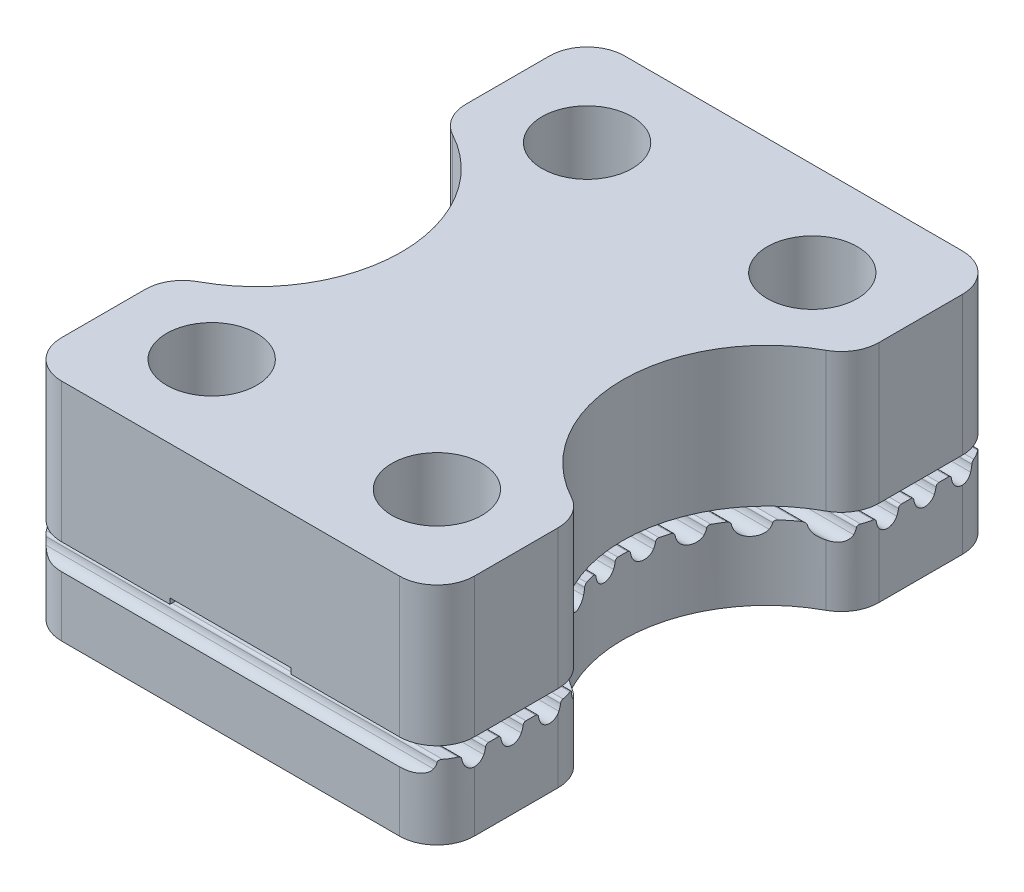
from build123d import *

# Parameters (mm, degrees)
BOSS_EXTRUDE1_DEPTH           = 12
CUT_EXTRUDE1_DEPTH            = 23.135943621
CUT_EXTRUDE1_DEPTH_BACK       = 23.135943621
SKETCH4_W                     = 2.4
SKETCH4_H                     = 12
M4_CLEARANCE_HOLE1_AT_2_COUNT = 2
M4_CLEARANCE_HOLE1_AT_2_PITCH = 12
M4_CLEARANCE_HOLE1_AT_3_COUNT = 2
M4_CLEARANCE_HOLE1_AT_3_PITCH = 20
M4_CLEARANCE_HOLE1_AT_4_COUNT = 2
M4_CLEARANCE_HOLE1_AT_4_PITCH = 23.323807579
CUT_EXTRUDE2_DEPTH            = 23.135943725
CUT_EXTRUDE2_DEPTH_BACK       = 23.135943725
SKETCH5_W                     = 6.45
SKETCH5_H                     = 0.3
FILLET1_R                     = 2
FILLET2_R                     = 2


with BuildPart() as part:
    # Sketch1 → Boss-Extrude1 (new body)
    with BuildSketch(Plane(origin=(0, 0, 0), x_dir=(1, 0, 0), z_dir=(0, 1, 0))):
        with BuildLine():
            Line((-11, -15), (11, -15))
            Line((11, -15), (11, -7.25))
            ThreePointArc((11, -7.25), (5.89374247, 0), (11, 7.25))
            Line((11, 7.25), (11, 15))
            Line((11, 15), (-11, 15))
            Line((-11, 15), (-11, 7.25))
            ThreePointArc((-11, 7.25), (-5.89374247, 0), (-11, -7.25))
            Line((-11, -7.25), (-11, -15))
        make_face()
    extrude(amount=-BOSS_EXTRUDE1_DEPTH)

    # Sketch2 → Cut-Extrude1 (cut, two sides: drawn at the far end of the back side and taken through both)
    with BuildSketch(Plane(origin=(0, 0, 0), x_dir=(0, 0, -1), z_dir=(1, 0, 0)).offset(-CUT_EXTRUDE1_DEPTH_BACK)):
        with BuildLine():
            Line((14, -7.42), (-15, -7.42))
            Line((-15, -7.42), (-16, -7.42))
            Line((-16, -7.42), (-16, -8.05))
            Line((-16, -8.05), (-15.740175425, -8.05))
            ThreePointArc((-15.740175425, -8.05), (-15.641268354, -8.087228588), (-15.591456891, -8.180434783))
            ThreePointArc((-15.591456891, -8.180434783), (-15.557611714, -8.338062154), (-15.498876404, -8.488202247))
            ThreePointArc((-15.498876404, -8.488202247), (-15, -8.8), (-14.501123596, -8.488202247))
            ThreePointArc((-14.501123596, -8.488202247), (-14.442388286, -8.338062154), (-14.408543109, -8.180434783))
            ThreePointArc((-14.408543109, -8.180434783), (-14.358731646, -8.087228588), (-14.259824575, -8.05))
            Line((-14.259824575, -8.05), (-14, -8.05))
            Line((-14, -8.05), (-13.740175425, -8.05))
            ThreePointArc((-13.740175425, -8.05), (-13.641268354, -8.087228588), (-13.591456891, -8.180434783))
            ThreePointArc((-13.591456891, -8.180434783), (-13.557611714, -8.338062154), (-13.498876404, -8.488202247))
            ThreePointArc((-13.498876404, -8.488202247), (-13, -8.8), (-12.501123596, -8.488202247))
            ThreePointArc((-12.501123596, -8.488202247), (-12.442388286, -8.338062154), (-12.408543109, -8.180434783))
            ThreePointArc((-12.408543109, -8.180434783), (-12.358731646, -8.087228588), (-12.259824575, -8.05))
            Line((-12.259824575, -8.05), (-12, -8.05))
            Line((-12, -8.05), (-11.740175425, -8.05))
            ThreePointArc((-11.740175425, -8.05), (-11.641268354, -8.087228588), (-11.591456891, -8.180434783))
            ThreePointArc((-11.591456891, -8.180434783), (-11.557611714, -8.338062154), (-11.498876404, -8.488202247))
            ThreePointArc((-11.498876404, -8.488202247), (-11, -8.8), (-10.501123596, -8.488202247))
            ThreePointArc((-10.501123596, -8.488202247), (-10.442388286, -8.338062154), (-10.408543109, -8.180434783))
            ThreePointArc((-10.408543109, -8.180434783), (-10.358731646, -8.087228588), (-10.259824575, -8.05))
            Line((-10.259824575, -8.05), (-10, -8.05))
            Line((-10, -8.05), (-9.740175425, -8.05))
            ThreePointArc((-9.740175425, -8.05), (-9.641268354, -8.087228588), (-9.591456891, -8.180434783))
            ThreePointArc((-9.591456891, -8.180434783), (-9.557611714, -8.338062154), (-9.498876404, -8.488202247))
            ThreePointArc((-9.498876404, -8.488202247), (-9, -8.8), (-8.501123596, -8.488202247))
            ThreePointArc((-8.501123596, -8.488202247), (-8.442388286, -8.338062154), (-8.408543109, -8.180434783))
            ThreePointArc((-8.408543109, -8.180434783), (-8.358731646, -8.087228588), (-8.259824575, -8.05))
            Line((-8.259824575, -8.05), (-8, -8.05))
            Line((-8, -8.05), (-7.740175425, -8.05))
            ThreePointArc((-7.740175425, -8.05), (-7.641268354, -8.087228588), (-7.591456891, -8.180434783))
            ThreePointArc((-7.591456891, -8.180434783), (-7.557611714, -8.338062154), (-7.498876404, -8.488202247))
            ThreePointArc((-7.498876404, -8.488202247), (-7, -8.8), (-6.501123596, -8.488202247))
            ThreePointArc((-6.501123596, -8.488202247), (-6.442388286, -8.338062154), (-6.408543109, -8.180434783))
            ThreePointArc((-6.408543109, -8.180434783), (-6.358731646, -8.087228588), (-6.259824575, -8.05))
            Line((-6.259824575, -8.05), (-6, -8.05))
            Line((-6, -8.05), (-5.740175425, -8.05))
            ThreePointArc((-5.740175425, -8.05), (-5.641268354, -8.087228588), (-5.591456891, -8.180434783))
            ThreePointArc((-5.591456891, -8.180434783), (-5.557611714, -8.338062154), (-5.498876404, -8.488202247))
            ThreePointArc((-5.498876404, -8.488202247), (-5, -8.8), (-4.501123596, -8.488202247))
            ThreePointArc((-4.501123596, -8.488202247), (-4.442388286, -8.338062154), (-4.408543109, -8.180434783))
            ThreePointArc((-4.408543109, -8.180434783), (-4.358731646, -8.087228588), (-4.259824575, -8.05))
            Line((-4.259824575, -8.05), (-4, -8.05))
            Line((-4, -8.05), (-3.740175425, -8.05))
            ThreePointArc((-3.740175425, -8.05), (-3.641268354, -8.087228588), (-3.591456891, -8.180434783))
            ThreePointArc((-3.591456891, -8.180434783), (-3.557611714, -8.338062154), (-3.498876404, -8.488202247))
            ThreePointArc((-3.498876404, -8.488202247), (-3, -8.8), (-2.501123596, -8.488202247))
            ThreePointArc((-2.501123596, -8.488202247), (-2.442388286, -8.338062154), (-2.408543109, -8.180434783))
            ThreePointArc((-2.408543109, -8.180434783), (-2.358731646, -8.087228588), (-2.259824575, -8.05))
            Line((-2.259824575, -8.05), (-2, -8.05))
            Line((-2, -8.05), (-1.740175425, -8.05))
            ThreePointArc((-1.740175425, -8.05), (-1.641268354, -8.087228588), (-1.591456891, -8.180434783))
            ThreePointArc((-1.591456891, -8.180434783), (-1.557611714, -8.338062154), (-1.498876404, -8.488202247))
            ThreePointArc((-1.498876404, -8.488202247), (-1, -8.8), (-0.501123596, -8.488202247))
            ThreePointArc((-0.501123596, -8.488202247), (-0.442388286, -8.338062154), (-0.408543109, -8.180434783))
            ThreePointArc((-0.408543109, -8.180434783), (-0.358731646, -8.087228588), (-0.259824575, -8.05))
            Line((-0.259824575, -8.05), (0, -8.05))
            Line((0, -8.05), (0.259824575, -8.05))
            ThreePointArc((0.259824575, -8.05), (0.358731646, -8.087228588), (0.408543109, -8.180434783))
            ThreePointArc((0.408543109, -8.180434783), (0.442388286, -8.338062154), (0.501123596, -8.488202247))
            ThreePointArc((0.501123596, -8.488202247), (1, -8.8), (1.498876404, -8.488202247))
            ThreePointArc((1.498876404, -8.488202247), (1.557611714, -8.338062154), (1.591456891, -8.180434783))
            ThreePointArc((1.591456891, -8.180434783), (1.641268354, -8.087228588), (1.740175425, -8.05))
            Line((1.740175425, -8.05), (2, -8.05))
            Line((2, -8.05), (2.259824575, -8.05))
            ThreePointArc((2.259824575, -8.05), (2.358731646, -8.087228588), (2.408543109, -8.180434783))
            ThreePointArc((2.408543109, -8.180434783), (2.442388286, -8.338062154), (2.501123596, -8.488202247))
            ThreePointArc((2.501123596, -8.488202247), (3, -8.8), (3.498876404, -8.488202247))
            ThreePointArc((3.498876404, -8.488202247), (3.557611714, -8.338062154), (3.591456891, -8.180434783))
            ThreePointArc((3.591456891, -8.180434783), (3.641268354, -8.087228588), (3.740175425, -8.05))
            Line((3.740175425, -8.05), (4, -8.05))
            Line((4, -8.05), (4.259824575, -8.05))
            ThreePointArc((4.259824575, -8.05), (4.358731646, -8.087228588), (4.408543109, -8.180434783))
            ThreePointArc((4.408543109, -8.180434783), (4.442388286, -8.338062154), (4.501123596, -8.488202247))
            ThreePointArc((4.501123596, -8.488202247), (5, -8.8), (5.498876404, -8.488202247))
            ThreePointArc((5.498876404, -8.488202247), (5.557611714, -8.338062154), (5.591456891, -8.180434783))
            ThreePointArc((5.591456891, -8.180434783), (5.641268354, -8.087228588), (5.740175425, -8.05))
            Line((5.740175425, -8.05), (6, -8.05))
            Line((6, -8.05), (6.259824575, -8.05))
            ThreePointArc((6.259824575, -8.05), (6.358731646, -8.087228588), (6.408543109, -8.180434783))
            ThreePointArc((6.408543109, -8.180434783), (6.442388286, -8.338062154), (6.501123596, -8.488202247))
            ThreePointArc((6.501123596, -8.488202247), (7, -8.8), (7.498876404, -8.488202247))
            ThreePointArc((7.498876404, -8.488202247), (7.557611714, -8.338062154), (7.591456891, -8.180434783))
            ThreePointArc((7.591456891, -8.180434783), (7.641268354, -8.087228588), (7.740175425, -8.05))
            Line((7.740175425, -8.05), (8, -8.05))
            Line((8, -8.05), (8.259824575, -8.05))
            ThreePointArc((8.259824575, -8.05), (8.358731646, -8.087228588), (8.408543109, -8.180434783))
            ThreePointArc((8.408543109, -8.180434783), (8.442388286, -8.338062154), (8.501123596, -8.488202247))
            ThreePointArc((8.501123596, -8.488202247), (9, -8.8), (9.498876404, -8.488202247))
            ThreePointArc((9.498876404, -8.488202247), (9.557611714, -8.338062154), (9.591456891, -8.180434783))
            ThreePointArc((9.591456891, -8.180434783), (9.641268354, -8.087228588), (9.740175425, -8.05))
            Line((9.740175425, -8.05), (10, -8.05))
            Line((10, -8.05), (10.259824575, -8.05))
            ThreePointArc((10.259824575, -8.05), (10.358731646, -8.087228588), (10.408543109, -8.180434783))
            ThreePointArc((10.408543109, -8.180434783), (10.442388286, -8.338062154), (10.501123596, -8.488202247))
            ThreePointArc((10.501123596, -8.488202247), (11, -8.8), (11.498876404, -8.488202247))
            ThreePointArc((11.498876404, -8.488202247), (11.557611714, -8.338062154), (11.591456891, -8.180434783))
            ThreePointArc((11.591456891, -8.180434783), (11.641268354, -8.087228588), (11.740175425, -8.05))
            Line((11.740175425, -8.05), (12, -8.05))
            Line((12, -8.05), (12.259824575, -8.05))
            ThreePointArc((12.259824575, -8.05), (12.358731646, -8.087228588), (12.408543109, -8.180434783))
            ThreePointArc((12.408543109, -8.180434783), (12.442388286, -8.338062154), (12.501123596, -8.488202247))
            ThreePointArc((12.501123596, -8.488202247), (13, -8.8), (13.498876404, -8.488202247))
            ThreePointArc((13.498876404, -8.488202247), (13.557611714, -8.338062154), (13.591456891, -8.180434783))
            ThreePointArc((13.591456891, -8.180434783), (13.641268354, -8.087228588), (13.740175425, -8.05))
            Line((13.740175425, -8.05), (14, -8.05))
            Line((14, -8.05), (14.259824575, -8.05))
            ThreePointArc((14.259824575, -8.05), (14.358731646, -8.087228588), (14.408543109, -8.180434783))
            ThreePointArc((14.408543109, -8.180434783), (14.442388286, -8.338062154), (14.501123596, -8.488202247))
            ThreePointArc((14.501123596, -8.488202247), (15, -8.8), (15.498876404, -8.488202247))
            ThreePointArc((15.498876404, -8.488202247), (15.557611714, -8.338062154), (15.591456891, -8.180434783))
            ThreePointArc((15.591456891, -8.180434783), (15.641268354, -8.087228588), (15.740175425, -8.05))
            Line((15.740175425, -8.05), (16, -8.05))
            Line((16, -8.05), (15, -7.42))
            Line((15, -7.42), (14, -7.42))
        make_face()
    extrude(amount=CUT_EXTRUDE1_DEPTH + CUT_EXTRUDE1_DEPTH_BACK, mode=Mode.SUBTRACT)


with BuildPart() as cut_extrude1_piece_1:
    # of the separate pieces the step leaves, piece 1, a body of its own (cut_extrude1_pieces)
    add(part.part.solids().sort_by_distance((-11, 0, 7.25))[0])


with BuildPart() as cut_extrude1_piece_2:
    # of the separate pieces the step leaves, piece 2, a body of its own (cut_extrude1_pieces)
    add(part.part.solids().sort_by_distance((-11, -8.740504793, 7.25))[0])


with BuildPart() as m4_clearance_hole1_tool:
    # Sketch4 → M4 Clearance Hole1 (revolve)
    with BuildSketch(Plane(origin=(6, 0, 10), x_dir=(0, 0, 1), z_dir=(1, 0, 0))):
        with Locations((1.2, 6)):
            Rectangle(SKETCH4_W, SKETCH4_H)
    m4_clearance_hole1 = revolve(axis=Axis((6, 6.35, 10), (0, -1, 0)))


with BuildPart() as cut_extrude1_piece_1_1:
    add(cut_extrude1_piece_1.part)

    # M4 Clearance Hole1: cut by m4_clearance_hole1_tool
    add(m4_clearance_hole1_tool.part, mode=Mode.SUBTRACT)


with BuildPart() as cut_extrude1_piece_2_1:
    add(cut_extrude1_piece_2.part)

    # M4 Clearance Hole1: cut by m4_clearance_hole1_tool
    add(m4_clearance_hole1_tool.part, mode=Mode.SUBTRACT)


with BuildPart() as m4_clearance_hole1_at_2_tool:
    # M4 Clearance Hole1 at 2: M4 Clearance Hole1 ×2
    with Locations(*[(-i * M4_CLEARANCE_HOLE1_AT_2_PITCH, 0, 0) for i in range(1, M4_CLEARANCE_HOLE1_AT_2_COUNT)]):
        add(m4_clearance_hole1)


with BuildPart() as cut_extrude1_piece_1_2:
    add(cut_extrude1_piece_1_1.part)

    # M4 Clearance Hole1 at 2: cut by m4_clearance_hole1_at_2_tool
    add(m4_clearance_hole1_at_2_tool.part, mode=Mode.SUBTRACT)


with BuildPart() as cut_extrude1_piece_2_2:
    add(cut_extrude1_piece_2_1.part)

    # M4 Clearance Hole1 at 2: cut by m4_clearance_hole1_at_2_tool
    add(m4_clearance_hole1_at_2_tool.part, mode=Mode.SUBTRACT)


with BuildPart() as m4_clearance_hole1_at_3_tool:
    # M4 Clearance Hole1 at 3: M4 Clearance Hole1 ×2
    with Locations(*[(0, 0, -i * M4_CLEARANCE_HOLE1_AT_3_PITCH) for i in range(1, M4_CLEARANCE_HOLE1_AT_3_COUNT)]):
        add(m4_clearance_hole1)


with BuildPart() as cut_extrude1_piece_1_3:
    add(cut_extrude1_piece_1_2.part)

    # M4 Clearance Hole1 at 3: cut by m4_clearance_hole1_at_3_tool
    add(m4_clearance_hole1_at_3_tool.part, mode=Mode.SUBTRACT)


with BuildPart() as cut_extrude1_piece_2_3:
    add(cut_extrude1_piece_2_2.part)

    # M4 Clearance Hole1 at 3: cut by m4_clearance_hole1_at_3_tool
    add(m4_clearance_hole1_at_3_tool.part, mode=Mode.SUBTRACT)


with BuildPart() as m4_clearance_hole1_at_4_tool:
    # M4 Clearance Hole1 at 4: M4 Clearance Hole1 ×2
    with Locations(*[Vector(-0.5144957554275266, 0, -0.8574929257125442) * (i * M4_CLEARANCE_HOLE1_AT_4_PITCH) for i in range(1, M4_CLEARANCE_HOLE1_AT_4_COUNT)]):
        add(m4_clearance_hole1)


with BuildPart() as cut_extrude1_piece_1_4:
    add(cut_extrude1_piece_1_3.part)

    # M4 Clearance Hole1 at 4: cut by m4_clearance_hole1_at_4_tool
    add(m4_clearance_hole1_at_4_tool.part, mode=Mode.SUBTRACT)

    # Sketch5 → Cut-Extrude2 (cut, two sides: drawn at the far end of the back side and taken through both)
    with BuildSketch(Plane.XY.offset(-CUT_EXTRUDE2_DEPTH_BACK)):
        with Locations((0, -7.27)):
            Rectangle(SKETCH5_W, SKETCH5_H)
    extrude(amount=CUT_EXTRUDE2_DEPTH + CUT_EXTRUDE2_DEPTH_BACK, mode=Mode.SUBTRACT)

    # Fillet1
    fillet1_edges = [cut_extrude1_piece_1_4.edges().sort_by_distance(p)[0] for p in [
        (11, -3.71, -7.25),
        (-11, -3.71, 15),
        (-11, -3.71, 7.25),
        (-11, -3.71, -7.25),
        (-11, -3.71, -15),
        (11, -3.71, -15),
        (11, -3.71, 7.25),
        (11, -3.71, 15),
    ]]
    fillet(fillet1_edges, radius=FILLET1_R)


with BuildPart() as cut_extrude1_piece_2_4:
    add(cut_extrude1_piece_2_3.part)

    # M4 Clearance Hole1 at 4: cut by m4_clearance_hole1_at_4_tool
    add(m4_clearance_hole1_at_4_tool.part, mode=Mode.SUBTRACT)

    # Fillet2
    fillet2_edges = [cut_extrude1_piece_2_4.edges().sort_by_distance(p)[0] for p in [
        (11, -10.4, -15),
        (-11, -10.4, -15),
        (-11, -10.370252397, -7.25),
        (-11, -10.370252397, 7.25),
        (-11, -10.4, 15),
        (11, -10.370252397, -7.25),
        (11, -10.370252397, 7.25),
        (11, -10.4, 15),
    ]]
    fillet(fillet2_edges, radius=FILLET2_R)


solid = Compound([cut_extrude1_piece_1_4.part, cut_extrude1_piece_2_4.part])
